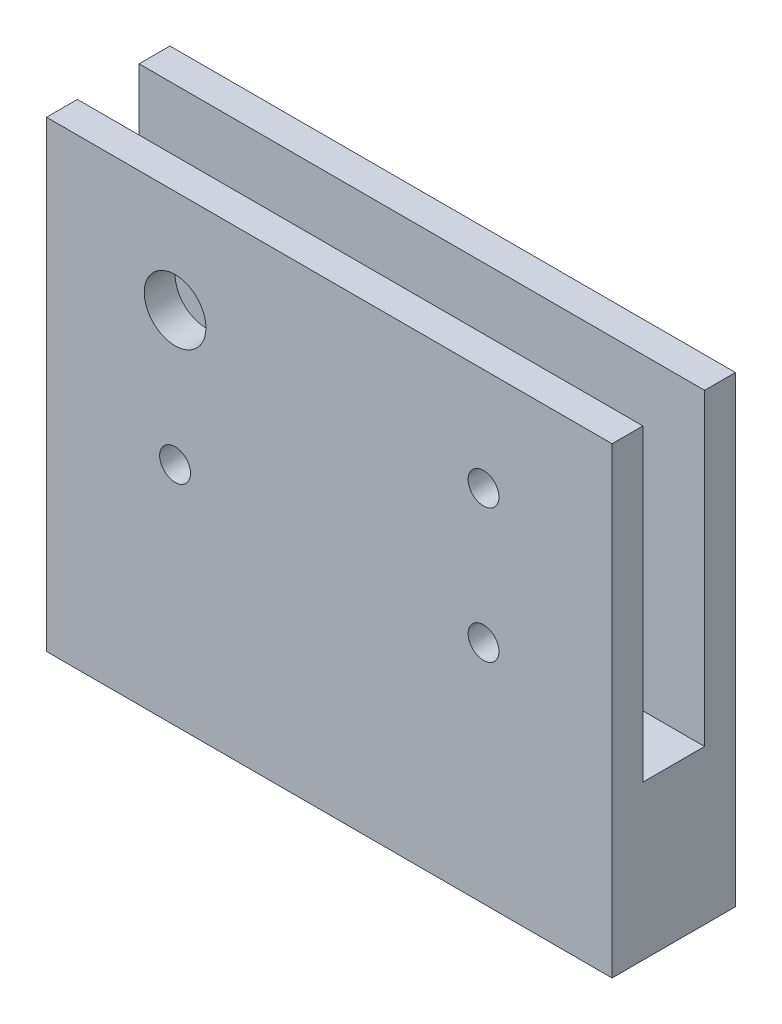
from build123d import *

# Parameters (mm, degrees)
SKETCH_1_W          = 55
SKETCH_1_H          = 45
EXTRUDE_1_DEPTH     = 12
SKETCH_2_W          = 6
SKETCH_2_H          = 30
CUT_EXTRUDE_1_DEPTH = 61.623840195
SKETCH_3_R          = 3
SKETCH_3_R_2        = 1.5
CUT_EXTRUDE_2_DEPTH = 38.503333185
SKETCH_4_R          = 1.5
CUT_EXTRUDE_3_DEPTH = 38.503333185


with BuildPart() as part:
    # 草图1 → 凸台-拉伸1 (new body)
    with BuildSketch(Plane.XY):
        Rectangle(SKETCH_1_W, SKETCH_1_H)
    extrude(amount=EXTRUDE_1_DEPTH)

    # 草图2 → 切除-拉伸1 (cut, through all)
    with BuildSketch(Plane.ZY.offset(27.5)):
        with Locations((6, 7.5)):
            Rectangle(SKETCH_2_W, SKETCH_2_H)
    extrude(amount=-CUT_EXTRUDE_1_DEPTH, mode=Mode.SUBTRACT)

    # 草图3 → 切除-拉伸2 (cut, through all)
    with BuildSketch(Plane.XY.offset(12)):
        with Locations((-15, 12.5)):
            Circle(SKETCH_3_R)
        with Locations((15, 12.5)):
            Circle(SKETCH_3_R_2)
    extrude(amount=-CUT_EXTRUDE_2_DEPTH, mode=Mode.SUBTRACT)

    # 草图4 → 切除-拉伸3 (cut, through all)
    with BuildSketch(Plane.XY.offset(12)):
        with Locations((-15, -0.5)):
            Circle(SKETCH_4_R)
        with Locations((15, -0.5)):
            Circle(SKETCH_4_R)
    extrude(amount=-CUT_EXTRUDE_3_DEPTH, mode=Mode.SUBTRACT)


solid = part.part
